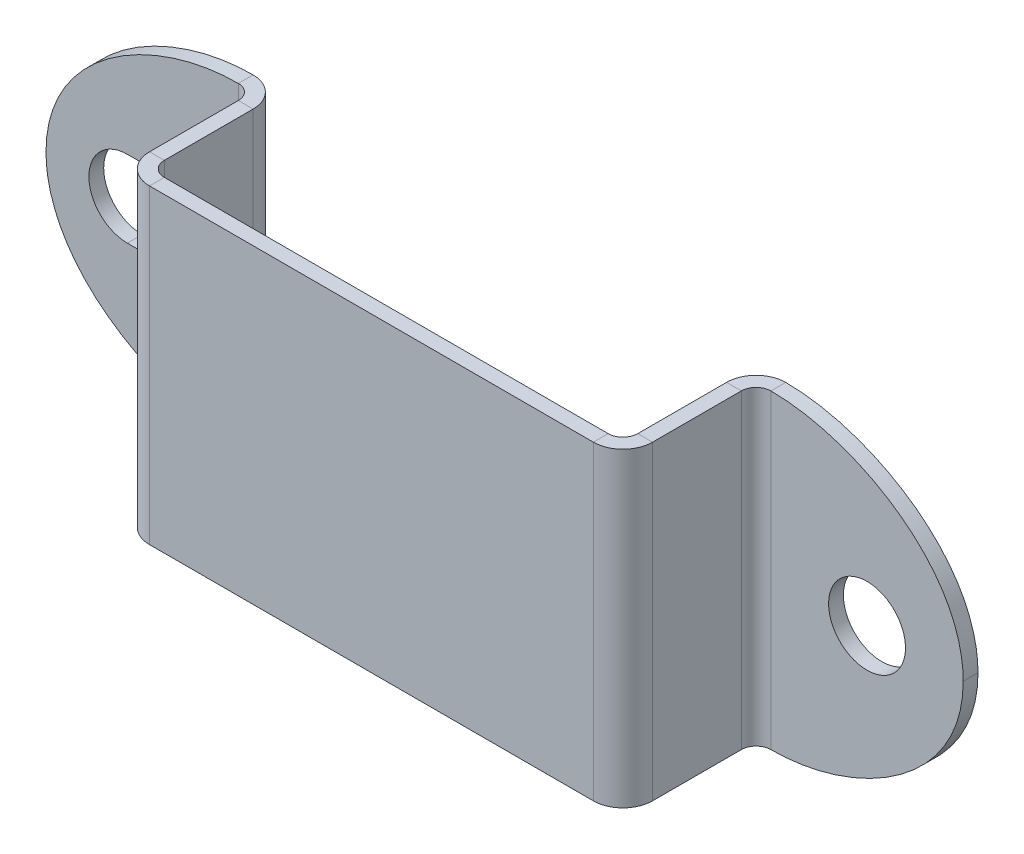
from build123d import *

# Parameters (mm, degrees)
BRIDA_BASE1_DEPTH     = 21
CROQUIS7_R            = 2.6
FORATS_CARGOLS_DEPTH  = 39.509739028
CORTAR_EXTRUIR1_DEPTH = 39.509739028


# Sheet-metal steps are written as plain solids
with BuildPart() as part:
    # Croquis1 → Brida base1 (new body)
    with BuildSketch(Plane(origin=(0, 0, 0), x_dir=(1, 0, 0), z_dir=(0, 1, 0))):
        with BuildLine():
            Line((-31, 0), (-18, 0))
            ThreePointArc((-18, 0), (-16.585786438, -0.585786438), (-16, -2))
            Line((-16, -2), (-16, -8))
            ThreePointArc((-16, -8), (-15.707106781, -8.707106781), (-15, -9))
            Line((-15, -9), (15, -9))
            ThreePointArc((15, -9), (15.707106781, -8.707106781), (16, -8))
            Line((16, -8), (16, -2))
            ThreePointArc((16, -2), (16.585786438, -0.585786438), (18, 0))
            Line((18, 0), (31, 0))
            Line((31, 0), (31, -1))
            Line((31, -1), (18, -1))
            ThreePointArc((18, -1), (17.292893219, -1.292893219), (17, -2))
            Line((17, -2), (17, -8))
            ThreePointArc((17, -8), (16.414213562, -9.414213562), (15, -10))
            Line((15, -10), (-15, -10))
            ThreePointArc((-15, -10), (-16.414213562, -9.414213562), (-17, -8))
            Line((-17, -8), (-17, -2))
            ThreePointArc((-17, -2), (-17.292893219, -1.292893219), (-18, -1))
            Line((-18, -1), (-31, -1))
            Line((-31, -1), (-31, 0))
        make_face()
    extrude(amount=BRIDA_BASE1_DEPTH)

    # Croquis7 → Forats cargols (cut, through all)
    with BuildSketch(Plane.XY.offset(1)):
        with Locations(Location((24.5, 10.5, 0), (0, 0, 180))):
            Circle(CROQUIS7_R)
        with BuildLine():
            Line((-23.5, 7.9), (-25.5, 7.9))
            ThreePointArc((-25.5, 7.9), (-28.1, 10.5), (-25.5, 13.1))
            Line((-25.5, 13.1), (-23.5, 13.1))
            ThreePointArc((-23.5, 13.1), (-20.9, 10.5), (-23.5, 7.9))
        make_face()
    extrude(amount=-FORATS_CARGOLS_DEPTH, mode=Mode.SUBTRACT)

    # Croquis8 → Cortar-Extruir1 (cut, through all)
    with BuildSketch(Plane.XY.offset(1)):
        with BuildLine():
            Line((-18, 21), (-32, 21))
            Line((-32, 21), (-32, 0))
            Line((-32, 0), (-18, 0))
            add(Edge.make_bspline(
                [(-18, 0), (-23.840607907, 0), (-31, 4.168476811), (-31, 10.5)],
                knots=[0, 0, 0, 0, 1, 1, 1, 1], degree=3))
            add(Edge.make_bspline(
                [(-18, 21), (-23.840607907, 21), (-31, 16.831523189), (-31, 10.5)],
                knots=[0, 0, 0, 0, 1, 1, 1, 1], degree=3))
        make_face()
        with BuildLine():
            Line((32, 0), (18, 0))
            add(Edge.make_bspline(
                [(18, 0), (23.840607907, 0), (31, 4.168476811), (31, 10.5)],
                knots=[0, 0, 0, 0, 1, 1, 1, 1], degree=3))
            add(Edge.make_bspline(
                [(18, 21), (23.840607907, 21), (31, 16.831523189), (31, 10.5)],
                knots=[0, 0, 0, 0, 1, 1, 1, 1], degree=3))
            Line((18, 21), (32, 21))
            Line((32, 21), (32, 0))
        make_face()
    extrude(amount=-CORTAR_EXTRUIR1_DEPTH, mode=Mode.SUBTRACT)


solid = part.part
